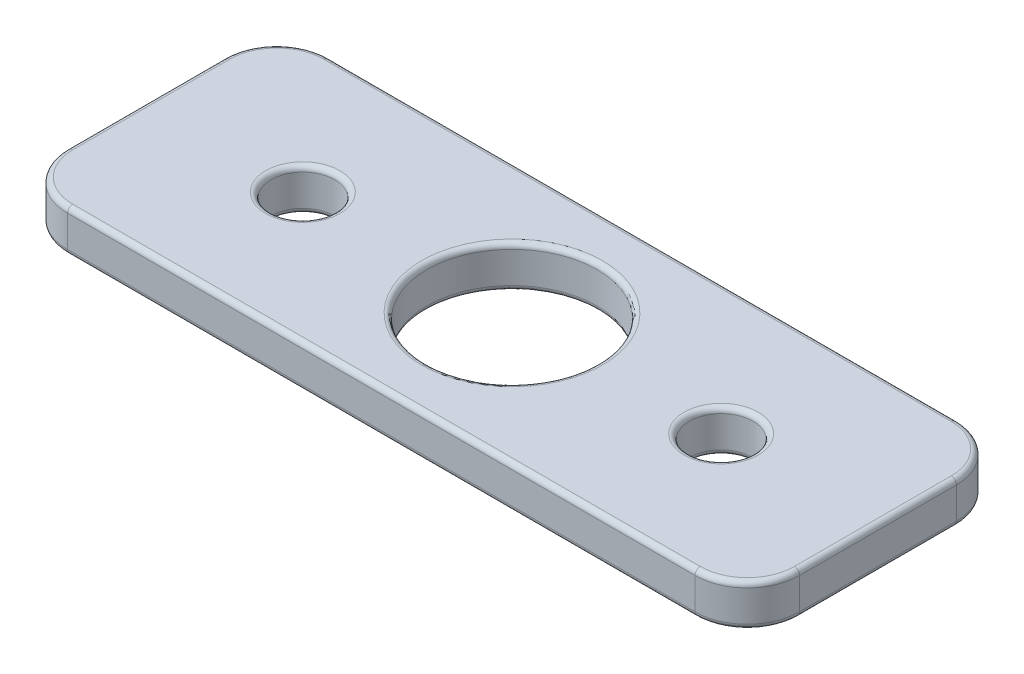
from build123d import *

# Parameters (mm, degrees)
SKETCH1_W           = 70
SKETCH1_H           = 25
SKETCH1_R           = 3.05
SKETCH1_R_2         = 8.15
BOSS_EXTRUDE1_DEPTH = 4
FILLET1_R           = 5
FILLET2_R           = 0.5


with BuildPart() as part:
    # Sketch1 → Boss-Extrude1 (new body)
    with BuildSketch(Plane(origin=(0, 0, 0), x_dir=(1, 0, 0), z_dir=(0, 1, 0))):
        with Locations((35, 12.5)):
            Rectangle(SKETCH1_W, SKETCH1_H)
        with Locations((15, 12.5)):
            Circle(SKETCH1_R, mode=Mode.SUBTRACT)
        with Locations((35, 12.5)):
            Circle(SKETCH1_R_2, mode=Mode.SUBTRACT)
        with Locations((55, 12.5)):
            Circle(SKETCH1_R, mode=Mode.SUBTRACT)
    extrude(amount=BOSS_EXTRUDE1_DEPTH)

    # Fillet1
    fillet1_edges = [part.edges().sort_by_distance(p)[0] for p in [
        (70, 2, -25),
        (0, 2, -25),
        (0, 2, 0),
        (70, 2, 0),
    ]]
    fillet(fillet1_edges, radius=FILLET1_R)

    # Fillet2
    fillet2_edges = [part.edges().sort_by_distance(p)[0] for p in [
        (51.95, 0, -12.5),
        (11.95, 0, -12.5),
        (1.464466094, 0, -23.535533906),
        (0, 0, -12.5),
        (1.464466094, 0, -1.464466094),
        (35, 0, 0),
        (68.535533906, 0, -1.464466094),
        (70, 0, -12.5),
        (68.535533906, 0, -23.535533906),
        (35, 0, -25),
        (26.85, 0, -12.5),
        (51.95, 4, -12.5),
        (26.85, 4, -12.5),
        (11.95, 4, -12.5),
        (68.535533906, 4, -1.464466094),
        (35, 4, 0),
        (1.464466094, 4, -1.464466094),
        (0, 4, -12.5),
        (1.464466094, 4, -23.535533906),
        (35, 4, -25),
        (68.535533906, 4, -23.535533906),
        (70, 4, -12.5),
    ]]
    fillet(fillet2_edges, radius=FILLET2_R)


solid = part.part
